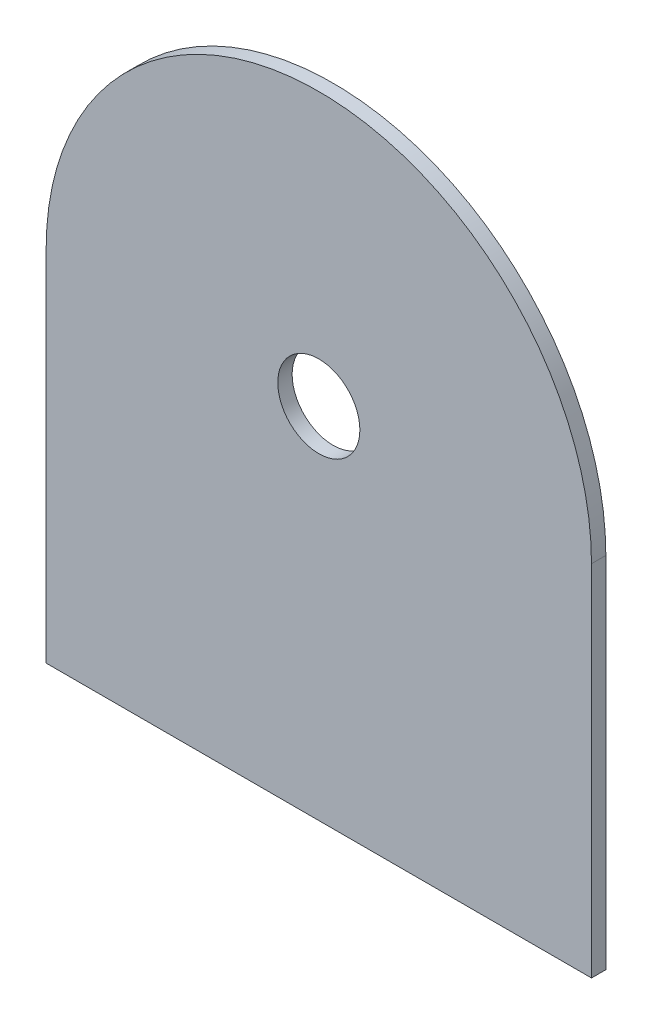
from build123d import *

# Parameters (mm, degrees)
OUTER_CASING_DEPTH = 5
SKETCH1_R          = 14.3
INNER_CUTOUT_DEPTH = 10


with BuildPart() as part:
    # Plate shape → Outer casing (new body)
    with BuildSketch(Plane.XY):
        with BuildLine():
            Line((-95, 0), (95, 0))
            Line((95, 0), (95, 125))
            ThreePointArc((95, 125), (0, 220), (-95, 125))
            Line((-95, 125), (-95, 0))
        make_face()
    extrude(amount=OUTER_CASING_DEPTH)

    # Sketch1 → Inner Cutout (cut)
    with BuildSketch(Plane.XY.offset(5)):
        with Locations((0, 125)):
            Circle(SKETCH1_R)
    extrude(amount=-INNER_CUTOUT_DEPTH, mode=Mode.SUBTRACT)


solid = part.part
